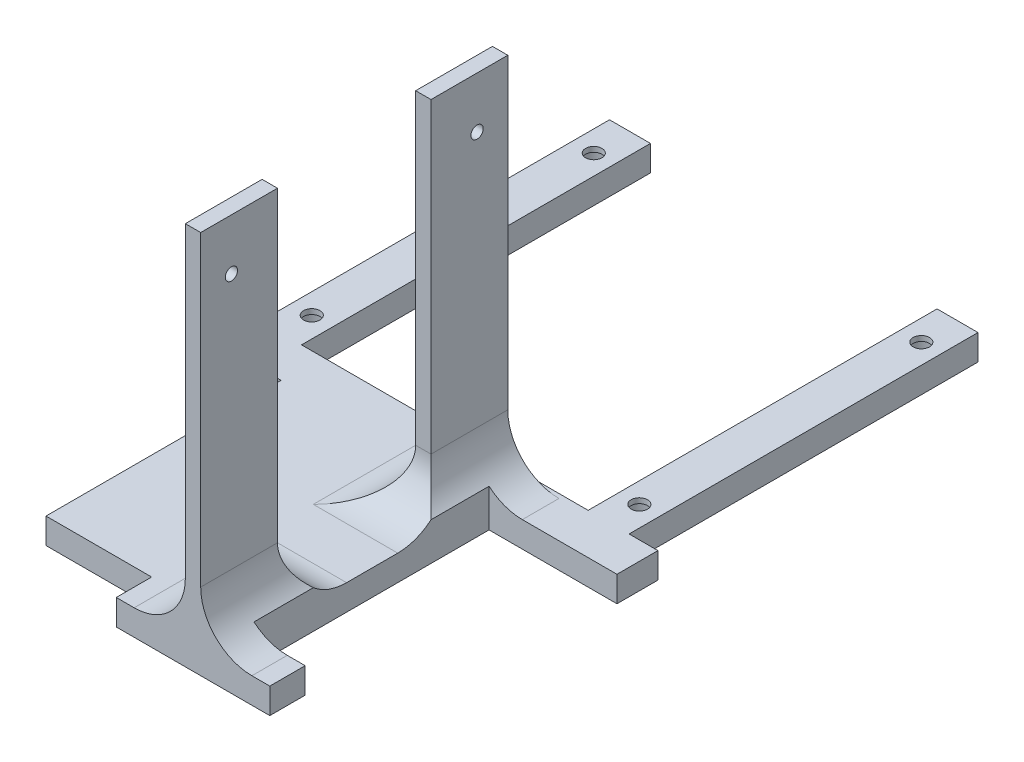
from build123d import *

# Parameters (mm, degrees)
SKETCH1_R           = 1.6
BOSS_EXTRUDE1_DEPTH = 5
SKETCH5_R           = 3
CUT_EXTRUDE6_DEPTH  = 4
SKETCH2_W           = 3
SKETCH2_H           = 15
BOSS_EXTRUDE2_DEPTH = 70
SKETCH3_R           = 1.2
CUT_EXTRUDE1_DEPTH  = 70
FILLET1_R           = 10


with BuildPart() as part:
    # Sketch1 → Boss-Extrude1 (new body)
    with BuildSketch(Plane(origin=(0, 0, 0), x_dir=(1, 0, 0), z_dir=(0, 1, 0))):
        Polygon((5, 22.84134835), (16.360076307, 22.84134835), (29.991927163, 22.84134835), (29.991927163, 30.010026716), (29.991927163, 30.84134835), (24.359090043, 30.84134835), (24.359090043, 92.100281359), (24.359090043, 99.017701748), (16.360076307, 99.017701748), (16.360076307, 92.100281359), (16.360076307, 30.84134835), (-39.640909957, 30.84134835), (-39.640909957, 88.100281359), (-39.640909957, 99.017701748), (-47.640909957, 99.017701748), (-47.640909957, 88.100281359), (-47.640909957, 30.84134835), (-51.640909957, 30.84134835), (-51.640909957, 22.84134835), (-44.008072837, 22.84134835), (-35.639923693, 22.84134835), (-35.639923693, -23.088281846), (-15, -23.088281846), (-15, -30), (15, -30), (15, -23.088281846), (5, -23.088281846), align=None)
        with Locations(Location((-43.540208284, 91.841256161, 0), (0, 0, 270))):
            Circle(SKETCH1_R, mode=Mode.SUBTRACT)
        with Locations(Location((20.459791716, 91.841256161, 0), (0, 0, 270))):
            Circle(SKETCH1_R, mode=Mode.SUBTRACT)
        with Locations(Location((-43.640909957, 36.84134835, 0), (0, 0, 270))):
            Circle(SKETCH1_R, mode=Mode.SUBTRACT)
        with Locations(Location((20.359090043, 36.84134835, 0), (0, 0, 270))):
            Circle(SKETCH1_R, mode=Mode.SUBTRACT)
    extrude(amount=BOSS_EXTRUDE1_DEPTH)

    # Sketch5 → Cut-Extrude6 (cut)
    with BuildSketch(Plane.XZ):
        with Locations(Location((20.459791716, -91.841256161, 0), (0, 0, 270))):
            Circle(SKETCH5_R)
        with Locations(Location((20.359090043, -36.84134835, 0), (0, 0, 270))):
            Circle(SKETCH5_R)
        with Locations(Location((-43.540208284, -91.841256161, 0), (0, 0, 270))):
            Circle(SKETCH5_R)
        with Locations(Location((-43.640909957, -36.84134835, 0), (0, 0, 270))):
            Circle(SKETCH5_R)
    extrude(amount=-CUT_EXTRUDE6_DEPTH, mode=Mode.SUBTRACT)

    # Sketch2 → Boss-Extrude2 (add)
    with BuildSketch(Plane(origin=(0, 5, 0), x_dir=(1, 0, 0), z_dir=(0, 1, 0))):
        with Locations((0, -22.5)):
            Rectangle(SKETCH2_W, SKETCH2_H)
        with Locations((0, 22.5)):
            Rectangle(SKETCH2_W, SKETCH2_H)
    extrude(amount=BOSS_EXTRUDE2_DEPTH)

    # Sketch3 → Cut-Extrude1 (cut)
    with BuildSketch(Plane.ZY.offset(1.5)):
        with Locations((-24, 65)):
            Circle(SKETCH3_R)
        with Locations((24, 65)):
            Circle(SKETCH3_R)
    extrude(amount=-CUT_EXTRUDE1_DEPTH, mode=Mode.SUBTRACT)

    # Fillet1
    # the kernel refuses this fillet: 10 mm, written as the material it adds along each edge
    with BuildSketch(Plane(origin=(-1.5, 5, 15), x_dir=(-1, 0, 0), z_dir=(0, 0, 1)), Plane(origin=(-1.5, 5, -30), x_dir=(-1, 0, 0), z_dir=(0, 0, 1))) as fillet1_piece_1:
        with BuildLine():
            CenterArc((FILLET1_R, -FILLET1_R), FILLET1_R, 90, 90)
            Line((0, -FILLET1_R), (0, 0))
            Line((0, 0), (FILLET1_R, 0))
        make_face()
    extrude(amount=15)
    with BuildSketch(Plane(origin=(1.5, 5, 30), x_dir=(1, 0, 0), z_dir=(0, 0, -1))) as fillet1_piece_2_section:
        with BuildLine():
            CenterArc((FILLET1_R, -FILLET1_R), FILLET1_R, 90, 90)
            Line((0, -FILLET1_R), (0, 0))
            Line((0, 0), (FILLET1_R, 0))
        make_face()
    fillet1_piece_2 = extrude(amount=40, mode=Mode.PRIVATE)
    fillet1_piece_2 = split(fillet1_piece_2, bisect_by=Plane(origin=(1.5, 5, 23.088281846), z_dir=(0, 0, 1)), keep=Keep.TOP, mode=Mode.PRIVATE)
    add(fillet1_piece_2)
    with BuildSketch(Plane(origin=(1.5, 5, 30), x_dir=(1, 0, 0), z_dir=(0, 0, -1))) as fillet1_piece_3_section:
        with BuildLine():
            CenterArc((FILLET1_R, -FILLET1_R), FILLET1_R, 90, 90)
            Line((0, -FILLET1_R), (0, 0))
            Line((0, 0), (FILLET1_R, 0))
        make_face()
    fillet1_piece_3 = extrude(amount=15, mode=Mode.PRIVATE)
    fillet1_piece_3 = split(fillet1_piece_3, bisect_by=Plane(origin=(5, 5, 30), z_dir=(-1, 0, 0)), keep=Keep.TOP, mode=Mode.PRIVATE)
    add(fillet1_piece_3)
    with BuildSketch(Plane(origin=(1.5, 5, 15), x_dir=(0, 0, -1), z_dir=(-1, 0, 0)), Plane(origin=(-1.5, 5, -15), x_dir=(0, 0, 1), z_dir=(1, 0, 0))) as fillet1_piece_4:
        with BuildLine():
            CenterArc((FILLET1_R, -FILLET1_R), FILLET1_R, 90, 90)
            Line((0, -FILLET1_R), (0, 0))
            Line((0, 0), (FILLET1_R, 0))
        make_face()
    extrude(amount=3)
    with BuildSketch(Plane(origin=(1.5, 5, -15), x_dir=(1, 0, 0), z_dir=(0, 0, -1))) as fillet1_piece_5_section:
        with BuildLine():
            CenterArc((FILLET1_R, -FILLET1_R), FILLET1_R, 90, 90)
            Line((0, -FILLET1_R), (0, 0))
            Line((0, 0), (FILLET1_R, 0))
        make_face()
    fillet1_piece_5 = extrude(amount=15, mode=Mode.PRIVATE)
    fillet1_piece_5 = split(fillet1_piece_5, bisect_by=Plane(origin=(5, 5, -15), z_dir=(-1, 0, 0)), keep=Keep.TOP, mode=Mode.PRIVATE)
    add(fillet1_piece_5)
    with BuildSketch(Plane(origin=(1.5, 5, 10), x_dir=(1, 0, 0), z_dir=(0, 0, -1))) as fillet1_piece_6_section:
        with BuildLine():
            CenterArc((FILLET1_R, -FILLET1_R), FILLET1_R, 90, 90)
            Line((0, -FILLET1_R), (0, 0))
            Line((0, 0), (FILLET1_R, 0))
        make_face()
    fillet1_piece_6 = extrude(amount=40, mode=Mode.PRIVATE)
    fillet1_piece_6 = split(fillet1_piece_6, bisect_by=Plane(origin=(1.5, 5, -22.84134835), z_dir=(0, 0, -1)), keep=Keep.TOP, mode=Mode.PRIVATE)
    add(fillet1_piece_6)
    with BuildSketch(Plane(origin=(1.5, 5, 15), x_dir=(0, 0, -1), z_dir=(-1, 0, 0))) as fillet1_piece_7a_section:
        with BuildLine():
            CenterArc((FILLET1_R, -FILLET1_R), FILLET1_R, 90, 90)
            Line((0, -FILLET1_R), (0, 0))
            Line((0, 0), (FILLET1_R, 0))
        make_face()
    fillet1_piece_7a = extrude(amount=28, mode=Mode.PRIVATE)
    fillet1_piece_7a = split(fillet1_piece_7a, bisect_by=Plane(origin=(-1.5, 5, 15), z_dir=(-1, 0, 0)), keep=Keep.TOP, mode=Mode.PRIVATE)
    with BuildSketch(Plane(origin=(-1.5, 5, -10), x_dir=(-1, 0, 0), z_dir=(0, 0, 1))) as fillet1_piece_7b_section:
        with BuildLine():
            CenterArc((FILLET1_R, -FILLET1_R), FILLET1_R, 90, 90)
            Line((0, -FILLET1_R), (0, 0))
            Line((0, 0), (FILLET1_R, 0))
        make_face()
    fillet1_piece_7b = extrude(amount=40, mode=Mode.PRIVATE)
    fillet1_piece_7b = split(fillet1_piece_7b, bisect_by=Plane(origin=(-1.5, 5, 15), z_dir=(0, 0, -1)), keep=Keep.TOP, mode=Mode.PRIVATE)
    fillet1_piece_7 = fillet1_piece_7a & fillet1_piece_7b
    add(fillet1_piece_7)
    with BuildSketch(Plane(origin=(1.5, 5, 30), x_dir=(1, 0, 0), z_dir=(0, 0, -1))) as fillet1_piece_8a_section:
        with BuildLine():
            CenterArc((FILLET1_R, -FILLET1_R), FILLET1_R, 90, 90)
            Line((0, -FILLET1_R), (0, 0))
            Line((0, 0), (FILLET1_R, 0))
        make_face()
    fillet1_piece_8a = extrude(amount=40, mode=Mode.PRIVATE)
    fillet1_piece_8a = split(fillet1_piece_8a, bisect_by=Plane(origin=(5, 5, 30), z_dir=(-1, 0, 0)), keep=Keep.TOP, mode=Mode.PRIVATE)
    fillet1_piece_8a = split(fillet1_piece_8a, bisect_by=Plane(origin=(1.5, 5, 15), z_dir=(0, 0, -1)), keep=Keep.TOP, mode=Mode.PRIVATE)
    with BuildSketch(Plane(origin=(26.5, 5, 15), x_dir=(0, 0, -1), z_dir=(-1, 0, 0))) as fillet1_piece_8b_section:
        with BuildLine():
            CenterArc((FILLET1_R, -FILLET1_R), FILLET1_R, 90, 90)
            Line((0, -FILLET1_R), (0, 0))
            Line((0, 0), (FILLET1_R, 0))
        make_face()
    fillet1_piece_8b = extrude(amount=28, mode=Mode.PRIVATE)
    fillet1_piece_8b = split(fillet1_piece_8b, bisect_by=Plane(origin=(5, 5, 15), z_dir=(-1, 0, 0)), keep=Keep.TOP, mode=Mode.PRIVATE)
    fillet1_piece_8b = split(fillet1_piece_8b, bisect_by=Plane(origin=(1.5, 5, 15), z_dir=(1, 0, 0)), keep=Keep.TOP, mode=Mode.PRIVATE)
    fillet1_piece_8 = fillet1_piece_8a & fillet1_piece_8b
    add(fillet1_piece_8)
    with BuildSketch(Plane(origin=(-26.5, 5, -15), x_dir=(0, 0, 1), z_dir=(1, 0, 0))) as fillet1_piece_9a_section:
        with BuildLine():
            CenterArc((FILLET1_R, -FILLET1_R), FILLET1_R, 90, 90)
            Line((0, -FILLET1_R), (0, 0))
            Line((0, 0), (FILLET1_R, 0))
        make_face()
    fillet1_piece_9a = extrude(amount=28, mode=Mode.PRIVATE)
    fillet1_piece_9a = split(fillet1_piece_9a, bisect_by=Plane(origin=(-1.5, 5, -15), z_dir=(-1, 0, 0)), keep=Keep.TOP, mode=Mode.PRIVATE)
    with BuildSketch(Plane(origin=(-1.5, 5, -30), x_dir=(-1, 0, 0), z_dir=(0, 0, 1))) as fillet1_piece_9b_section:
        with BuildLine():
            CenterArc((FILLET1_R, -FILLET1_R), FILLET1_R, 90, 90)
            Line((0, -FILLET1_R), (0, 0))
            Line((0, 0), (FILLET1_R, 0))
        make_face()
    fillet1_piece_9b = extrude(amount=40, mode=Mode.PRIVATE)
    fillet1_piece_9b = split(fillet1_piece_9b, bisect_by=Plane(origin=(-1.5, 5, -15), z_dir=(0, 0, 1)), keep=Keep.TOP, mode=Mode.PRIVATE)
    fillet1_piece_9 = fillet1_piece_9a & fillet1_piece_9b
    add(fillet1_piece_9)
    with BuildSketch(Plane(origin=(-1.5, 5, -15), x_dir=(0, 0, 1), z_dir=(1, 0, 0))) as fillet1_piece_10a_section:
        with BuildLine():
            CenterArc((FILLET1_R, -FILLET1_R), FILLET1_R, 90, 90)
            Line((0, -FILLET1_R), (0, 0))
            Line((0, 0), (FILLET1_R, 0))
        make_face()
    fillet1_piece_10a = extrude(amount=28, mode=Mode.PRIVATE)
    fillet1_piece_10a = split(fillet1_piece_10a, bisect_by=Plane(origin=(5, 5, -15), z_dir=(-1, 0, 0)), keep=Keep.TOP, mode=Mode.PRIVATE)
    fillet1_piece_10a = split(fillet1_piece_10a, bisect_by=Plane(origin=(1.5, 5, -15), z_dir=(1, 0, 0)), keep=Keep.TOP, mode=Mode.PRIVATE)
    with BuildSketch(Plane(origin=(1.5, 5, 10), x_dir=(1, 0, 0), z_dir=(0, 0, -1))) as fillet1_piece_10b_section:
        with BuildLine():
            CenterArc((FILLET1_R, -FILLET1_R), FILLET1_R, 90, 90)
            Line((0, -FILLET1_R), (0, 0))
            Line((0, 0), (FILLET1_R, 0))
        make_face()
    fillet1_piece_10b = extrude(amount=40, mode=Mode.PRIVATE)
    fillet1_piece_10b = split(fillet1_piece_10b, bisect_by=Plane(origin=(5, 5, 10), z_dir=(-1, 0, 0)), keep=Keep.TOP, mode=Mode.PRIVATE)
    fillet1_piece_10b = split(fillet1_piece_10b, bisect_by=Plane(origin=(1.5, 5, -15), z_dir=(0, 0, 1)), keep=Keep.TOP, mode=Mode.PRIVATE)
    fillet1_piece_10 = fillet1_piece_10a & fillet1_piece_10b
    add(fillet1_piece_10)


solid = part.part
